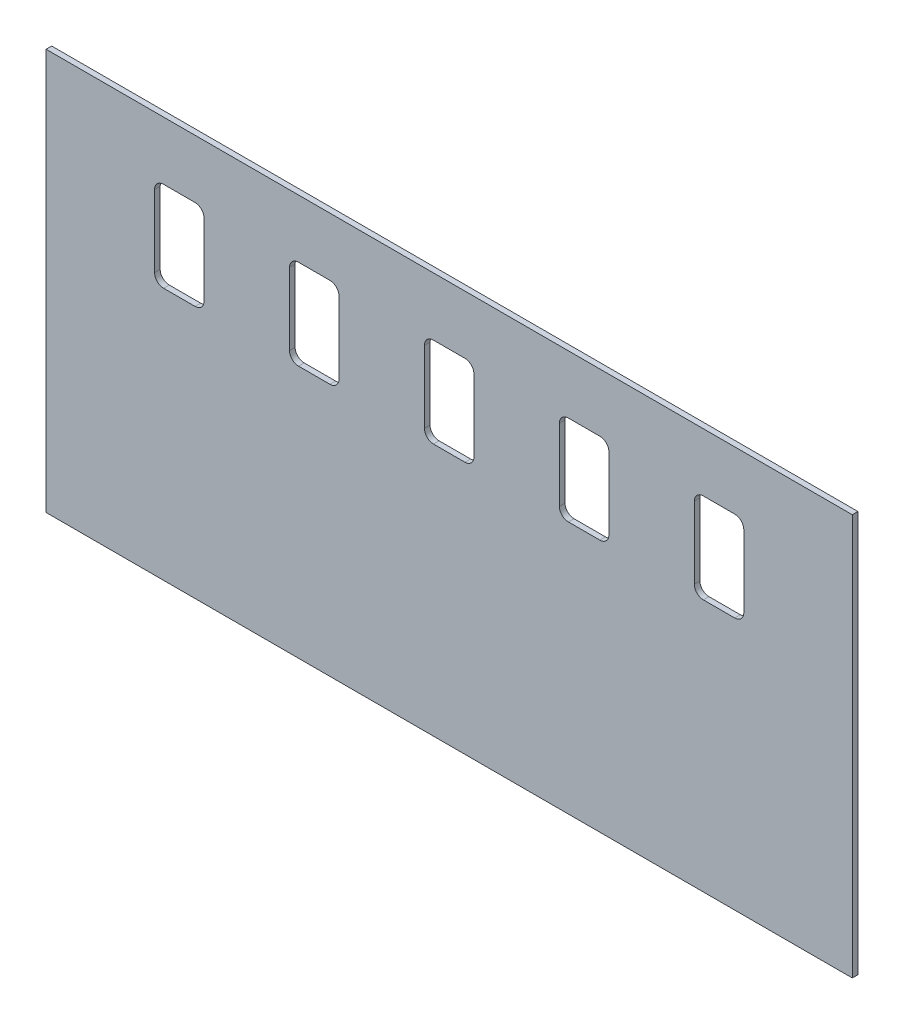
from build123d import *

# Parameters (mm, degrees)
SKETCH3_W           = 455.295
SKETCH3_H           = 226.568
BOSS_EXTRUDE1_DEPTH = 1.5875
CUT_EXTRUDE1_DEPTH  = 25.4


with BuildPart() as part:
    # Sketch3 → Boss-Extrude1 (new, symmetric)
    with BuildSketch(Plane.XY):
        Rectangle(SKETCH3_W, SKETCH3_H)
    extrude(amount=BOSS_EXTRUDE1_DEPTH, both=True)

    # Sketch4 → Cut-Extrude1 (cut)
    with BuildSketch(Plane.XY.offset(1.5875)):
        with BuildLine():
            Line((-161.29, 80.391001016), (-143.51, 80.391001016))
            ThreePointArc((-143.51, 80.391001016), (-139.917897552, 78.903103464), (-138.43, 75.311001016))
            Line((-138.43, 75.311001016), (-138.43, 34.671001016))
            ThreePointArc((-138.43, 34.671001016), (-139.917897552, 31.078898568), (-143.51, 29.591001016))
            Line((-143.51, 29.591001016), (-161.29, 29.591001016))
            ThreePointArc((-161.29, 29.591001016), (-164.882102448, 31.078898568), (-166.37, 34.671001016))
            Line((-166.37, 34.671001016), (-166.37, 75.311001016))
            ThreePointArc((-166.37, 75.311001016), (-164.882102448, 78.903103464), (-161.29, 80.391001016))
        make_face()
        with BuildLine():
            Line((-8.89, 80.391001016), (8.89, 80.391001016))
            ThreePointArc((8.89, 80.391001016), (12.482102448, 78.903103464), (13.97, 75.311001016))
            Line((13.97, 75.311001016), (13.97, 34.671001016))
            ThreePointArc((13.97, 34.671001016), (12.482102448, 31.078898568), (8.89, 29.591001016))
            Line((8.89, 29.591001016), (-8.89, 29.591001016))
            ThreePointArc((-8.89, 29.591001016), (-12.482102448, 31.078898568), (-13.97, 34.671001016))
            Line((-13.97, 34.671001016), (-13.97, 75.311001016))
            ThreePointArc((-13.97, 75.311001016), (-12.482102448, 78.903103464), (-8.89, 80.391001016))
        make_face()
        with BuildLine():
            Line((67.31, 80.391001016), (85.09, 80.391001016))
            ThreePointArc((85.09, 80.391001016), (88.682102448, 78.903103464), (90.17, 75.311001016))
            Line((90.17, 75.311001016), (90.17, 34.671001016))
            ThreePointArc((90.17, 34.671001016), (88.682102448, 31.078898568), (85.09, 29.591001016))
            Line((85.09, 29.591001016), (67.31, 29.591001016))
            ThreePointArc((67.31, 29.591001016), (63.717897552, 31.078898568), (62.23, 34.671001016))
            Line((62.23, 34.671001016), (62.23, 75.311001016))
            ThreePointArc((62.23, 75.311001016), (63.717897552, 78.903103464), (67.31, 80.391001016))
        make_face()
        with BuildLine():
            Line((143.51, 80.391001016), (161.29, 80.391001016))
            ThreePointArc((161.29, 80.391001016), (164.882102448, 78.903103464), (166.37, 75.311001016))
            Line((166.37, 75.311001016), (166.37, 34.671001016))
            ThreePointArc((166.37, 34.671001016), (164.882102448, 31.078898568), (161.29, 29.591001016))
            Line((161.29, 29.591001016), (143.51, 29.591001016))
            ThreePointArc((143.51, 29.591001016), (139.917897552, 31.078898568), (138.43, 34.671001016))
            Line((138.43, 34.671001016), (138.43, 75.311001016))
            ThreePointArc((138.43, 75.311001016), (139.917897552, 78.903103464), (143.51, 80.391001016))
        make_face()
        with BuildLine():
            Line((-85.09, 80.391001016), (-67.31, 80.391001016))
            ThreePointArc((-67.31, 80.391001016), (-63.717897552, 78.903103464), (-62.23, 75.311001016))
            Line((-62.23, 75.311001016), (-62.23, 34.671001016))
            ThreePointArc((-62.23, 34.671001016), (-63.717897552, 31.078898568), (-67.31, 29.591001016))
            Line((-67.31, 29.591001016), (-85.09, 29.591001016))
            ThreePointArc((-85.09, 29.591001016), (-88.682102448, 31.078898568), (-90.17, 34.671001016))
            Line((-90.17, 34.671001016), (-90.17, 75.311001016))
            ThreePointArc((-90.17, 75.311001016), (-88.682102448, 78.903103464), (-85.09, 80.391001016))
        make_face()
    extrude(amount=-CUT_EXTRUDE1_DEPTH, mode=Mode.SUBTRACT)


solid = part.part
